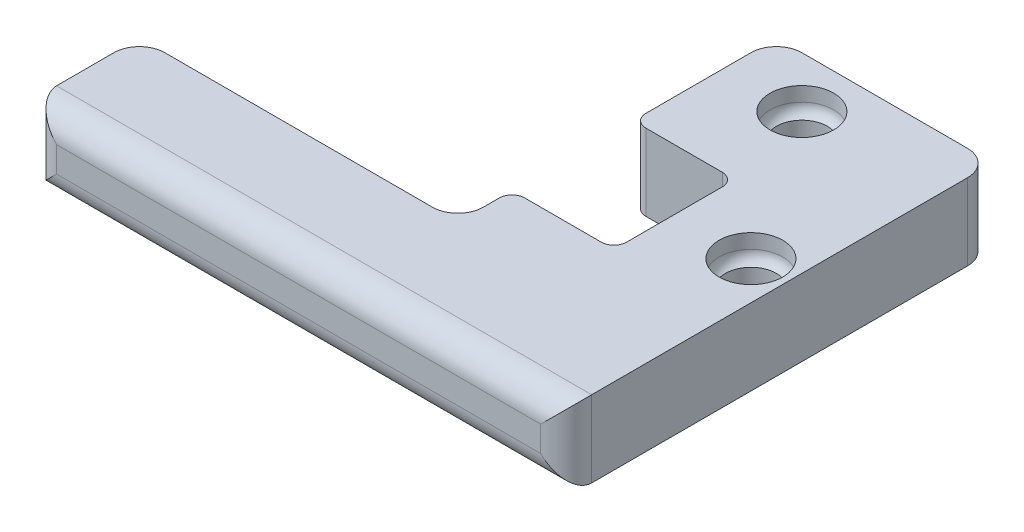
from build123d import *

# Parameters (mm, degrees)
SKETCH1_W           = 17
SKETCH1_H           = 25
BOSS_EXTRUDE1_DEPTH = 6
SKETCH2_R           = 2
CUT_EXTRUDE1_DEPTH  = 40.990623901
FILLET2_R           = 2
FILLET1_R           = 2
CUT_EXTRUDE2_START  = -4
SKETCH3_R           = 2.5
CUT_EXTRUDE2_DEPTH  = 36.990623901
FILLET3_R           = 1
CHAMFER1_SIZE       = 0.5
SKETCH4_W           = 8
SKETCH4_H           = 9.5
CUT_EXTRUDE3_DEPTH  = 40.990623901
FILLET4_R           = 1


with BuildPart() as part:
    # Sketch1 → Boss-Extrude1 (new body)
    with BuildSketch(Plane(origin=(0, 0, 0), x_dir=(1, 0, 0), z_dir=(0, 1, 0))):
        Polygon((8.5, -12.5), (-8.5, -12.5), (-33.5, -12.5), (-33.5, -21), (8.5, -21), align=None)
        Rectangle(SKETCH1_W, SKETCH1_H)
    extrude(amount=BOSS_EXTRUDE1_DEPTH)

    # Sketch2 → Cut-Extrude1 (cut, through all)
    with BuildSketch(Plane(origin=(0, 6, 0), x_dir=(1, 0, 0), z_dir=(0, 1, 0))):
        with Locations(Location((-2.5, 8.5, 0), (0, 0, 270))):
            Circle(SKETCH2_R)
        with Locations(Location((5.5, -3.5, 0), (0, 0, 270))):
            Circle(SKETCH2_R)
    extrude(amount=-CUT_EXTRUDE1_DEPTH, mode=Mode.SUBTRACT)

    # Fillet2
    fillet2_edges = [part.edges().sort_by_distance(p)[0] for p in [
        (8.5, 3, 21),
        (-33.5, 3, 21),
        (-12.5, 6, 21),
        (-12.5, 0, 21),
    ]]
    fillet(fillet2_edges, radius=FILLET2_R)

    # Fillet1
    fillet1_edges = [part.edges().sort_by_distance(p)[0] for p in [
        (-8.5, 3, 12.5),
        (-8.5, 3, -12.5),
        (8.5, 3, -12.5),
        (-33.5, 3, 12.5),
    ]]
    fillet(fillet1_edges, radius=FILLET1_R)

    # Sketch3 → Cut-Extrude2 (cut, through all)
    with BuildSketch(Plane.XZ.offset(CUT_EXTRUDE2_START)):
        with Locations(Location((5.5, 3.5, 0), (0, 0, 270))):
            Circle(SKETCH3_R)
        with Locations(Location((-2.5, -8.5, 0), (0, 0, 270))):
            Circle(SKETCH3_R)
    extrude(amount=-CUT_EXTRUDE2_DEPTH, mode=Mode.SUBTRACT)

    # Fillet3
    # the kernel refuses this fillet: 1 mm, written as the material it adds along each edge
    with BuildSketch(Plane(origin=(5.5, 4, 3.5), x_dir=(0, 0, -1), z_dir=(-1, 0, 0))) as fillet3_piece_1:
        with BuildLine():
            CenterArc((1.5, -0.866025404), FILLET3_R, 0, 60)
            Line((2.5, -0.866025404), (2.52, -0.866025404))
            Line((2.52, -0.866025404), (2.52, 0))
            Line((2.52, 0), (2.5, 0.02))
            ThreePointArc((2.5, 0.02), (2.25, 0.02), (2.01, 0.017320508))
            Line((2.01, 0.017320508), (2, 0))
        make_face()
    revolve(axis=Axis((5.5, 4, 3.5), (0, -1, 0)))
    with BuildSketch(Plane(origin=(-2.5, 4, -8.5), x_dir=(0, 0, -1), z_dir=(-1, 0, 0))) as fillet3_piece_2:
        with BuildLine():
            CenterArc((1.5, -0.866025404), FILLET3_R, 0, 60)
            Line((2.5, -0.866025404), (2.52, -0.866025404))
            Line((2.52, -0.866025404), (2.52, 0))
            Line((2.52, 0), (2.5, 0.02))
            ThreePointArc((2.5, 0.02), (2.25, 0.02), (2.01, 0.017320508))
            Line((2.01, 0.017320508), (2, 0))
        make_face()
    revolve(axis=Axis((-2.5, 4, -8.5), (0, -1, 0)))

    # Chamfer1
    chamfer1_edges = [part.edges().sort_by_distance(p)[0] for p in [
        (-2.5, 0, -10.5),
        (5.5, 0, 1.5),
    ]]
    chamfer(chamfer1_edges, length=CHAMFER1_SIZE)

    # Sketch4 → Cut-Extrude3 (cut, through all)
    with BuildSketch(Plane(origin=(0, 6, 0), x_dir=(1, 0, 0), z_dir=(0, 1, 0))):
        with Locations((-4.5, -3.5)):
            Rectangle(SKETCH4_W, SKETCH4_H)
    extrude(amount=-CUT_EXTRUDE3_DEPTH, mode=Mode.SUBTRACT)

    # Fillet4
    fillet4_edges = [part.edges().sort_by_distance(p)[0] for p in [
        (-0.5, 3, -1.25),
        (-0.5, 3, 8.25),
        (-8.5, 3, 8.25),
        (-8.5, 3, -1.25),
    ]]
    fillet(fillet4_edges, radius=FILLET4_R)


solid = part.part
